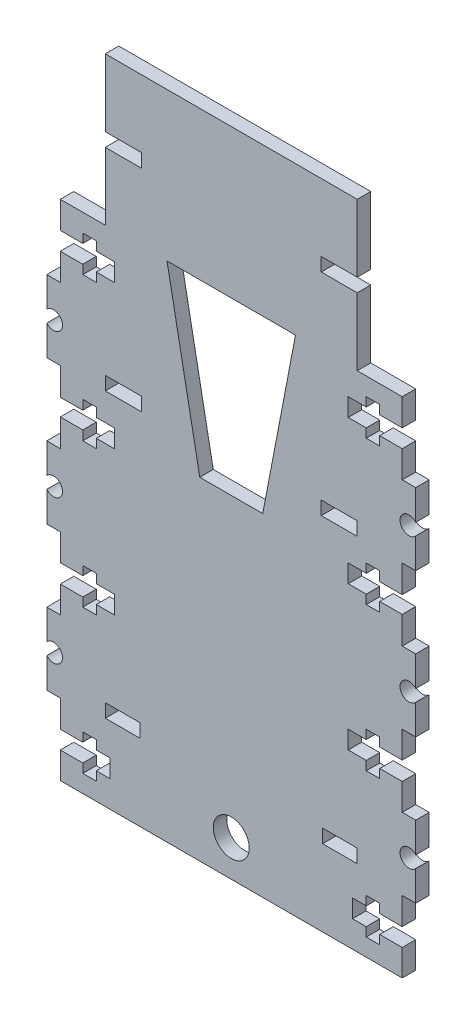
from build123d import *

# Parameters (mm, degrees)
SKETCH_1_W      = 7.702280229
SKETCH_1_H      = 3
SKETCH_1_R      = 4
SKETCH_1_W_2    = 8
EXTRUDE_1_DEPTH = 3


with BuildPart() as part:
    # 草图1 → 凸台-拉伸1 (new body)
    with BuildSketch(Plane.XY):
        with BuildLine():
            Line((0, 21.943589238), (0, 16))
            Line((0, 16), (-3, 16))
            Line((-3, 16), (-3, 9.322875656))
            ThreePointArc((-3, 9.322875656), (-0.792893219, 9.870828693), (0.5, 8))
            ThreePointArc((0.5, 8), (-0.792893219, 6.129171307), (-3, 6.677124344))
            Line((-3, 6.677124344), (-3, 0))
            Line((-3, 0), (0, 0))
            Line((0, 0), (0, -6))
            Line((0, -6), (5, -6))
            Line((5, -6), (5, -4))
            Line((5, -4), (8, -4))
            Line((8, -4), (8, -6))
            Line((8, -6), (11.049435588, -6))
            Line((11.049435588, -6), (11.049435588, -10))
            Line((11.049435588, -10), (8, -10))
            Line((8, -10), (8, -12))
            Line((8, -12), (5, -12))
            Line((5, -12), (5, -10))
            Line((5, -10), (0, -10))
            Line((0, -10), (0, -15.884432035))
            Line((0, -15.884432035), (76, -15.884432035))
            Line((76, -15.884432035), (76, -10))
            Line((76, -10), (71, -10))
            Line((71, -10), (71, -12))
            Line((71, -12), (68, -12))
            Line((68, -12), (68, -10))
            Line((68, -10), (64.950564412, -10))
            Line((64.950564412, -10), (64.950564412, -6))
            Line((64.950564412, -6), (68, -6))
            Line((68, -6), (68, -4))
            Line((68, -4), (71, -4))
            Line((71, -4), (71, -6))
            Line((71, -6), (76, -6))
            Line((76, -6), (76, 0))
            Line((76, 0), (79, 0))
            Line((79, 0), (79, 6.677124344))
            ThreePointArc((79, 6.677124344), (75.5, 8), (79, 9.322875656))
            Line((79, 9.322875656), (79, 16))
            Line((79, 16), (76, 16))
            Line((76, 16), (76, 21.943589238))
            Line((76, 21.943589238), (71, 21.943589238))
            Line((71, 21.943589238), (71, 20))
            Line((71, 20), (68, 20))
            Line((68, 20), (68, 22))
            Line((68, 22), (64, 22))
            Line((64, 22), (64, 26))
            Line((64, 26), (68, 26))
            Line((68, 26), (68, 28))
            Line((68, 28), (71, 28))
            Line((71, 28), (71, 26.056410762))
            Line((71, 26.056410762), (76, 26.056410762))
            Line((76, 26.056410762), (76, 32))
            Line((76, 32), (79, 32))
            Line((79, 32), (79, 38.677124344))
            ThreePointArc((79, 38.677124344), (75.5, 40), (79, 41.322875656))
            Line((79, 41.322875656), (79, 48))
            Line((79, 48), (76, 48))
            Line((76, 48), (76, 54.106340664))
            Line((76, 54.106340664), (71, 54.106340664))
            Line((71, 54.106340664), (71, 52))
            Line((71, 52), (68, 52))
            Line((68, 52), (68, 54))
            Line((68, 54), (64, 54))
            Line((64, 54), (64, 58))
            Line((64, 58), (68, 58))
            Line((68, 58), (68, 60))
            Line((68, 60), (71, 60))
            Line((71, 60), (71, 57.893659336))
            Line((71, 57.893659336), (76, 57.893659336))
            Line((76, 57.893659336), (76, 64))
            Line((76, 64), (79, 64))
            Line((79, 64), (79, 70.677124344))
            ThreePointArc((79, 70.677124344), (75.5, 72), (79, 73.322875656))
            Line((79, 73.322875656), (79, 80))
            Line((79, 80), (76, 80))
            Line((76, 80), (76, 86))
            Line((76, 86), (71, 86))
            Line((71, 86), (71, 84))
            Line((71, 84), (68, 84))
            Line((68, 84), (68, 86))
            Line((68, 86), (64, 86))
            Line((64, 86), (64, 90))
            Line((64, 90), (68, 90))
            Line((68, 90), (68, 92))
            Line((68, 92), (71, 92))
            Line((71, 92), (71, 90))
            Line((71, 90), (76, 90))
            Line((76, 90), (76, 96))
            Line((76, 96), (66, 96))
            Line((66, 96), (66, 111))
            Line((66, 111), (58, 111))
            Line((58, 111), (58, 114))
            Line((58, 114), (66, 114))
            Line((66, 114), (66, 129))
            Line((66, 129), (10, 129))
            Line((10, 129), (10, 114))
            Line((10, 114), (18, 114))
            Line((18, 114), (18, 111))
            Line((18, 111), (10, 111))
            Line((10, 111), (10, 96))
            Line((10, 96), (0, 96))
            Line((0, 96), (0, 90))
            Line((0, 90), (5, 90))
            Line((5, 90), (5, 92))
            Line((5, 92), (8, 92))
            Line((8, 92), (8, 90))
            Line((8, 90), (12, 90))
            Line((12, 90), (12, 86))
            Line((12, 86), (8, 86))
            Line((8, 86), (8, 84))
            Line((8, 84), (5, 84))
            Line((5, 84), (5, 86))
            Line((5, 86), (0, 86))
            Line((0, 86), (0, 80))
            Line((0, 80), (-3, 80))
            Line((-3, 80), (-3, 73.322875656))
            ThreePointArc((-3, 73.322875656), (-0.792893219, 73.870828693), (0.5, 72))
            ThreePointArc((0.5, 72), (-0.792893219, 70.129171307), (-3, 70.677124344))
            Line((-3, 70.677124344), (-3, 64))
            Line((-3, 64), (0, 64))
            Line((0, 64), (0, 57.893659336))
            Line((0, 57.893659336), (5, 57.893659336))
            Line((5, 57.893659336), (5, 60))
            Line((5, 60), (8, 60))
            Line((8, 60), (8, 58))
            Line((8, 58), (12, 58))
            Line((12, 58), (12, 54))
            Line((12, 54), (8, 54))
            Line((8, 54), (8, 52))
            Line((8, 52), (5, 52))
            Line((5, 52), (5, 54.106340664))
            Line((5, 54.106340664), (0, 54.106340664))
            Line((0, 54.106340664), (0, 48))
            Line((0, 48), (-3, 48))
            Line((-3, 48), (-3, 41.322875656))
            ThreePointArc((-3, 41.322875656), (-0.792893219, 41.870828693), (0.5, 40))
            ThreePointArc((0.5, 40), (-0.792893219, 38.129171307), (-3, 38.677124344))
            Line((-3, 38.677124344), (-3, 32))
            Line((-3, 32), (0, 32))
            Line((0, 32), (0, 26.056410762))
            Line((0, 26.056410762), (5, 26.056410762))
            Line((5, 26.056410762), (5, 28))
            Line((5, 28), (8, 28))
            Line((8, 28), (8, 26))
            Line((8, 26), (12, 26))
            Line((12, 26), (12, 22))
            Line((12, 22), (8, 22))
            Line((8, 22), (8, 20))
            Line((8, 20), (5, 20))
            Line((5, 20), (5, 21.943589238))
            Line((5, 21.943589238), (0, 21.943589238))
        make_face()
        with Locations((13.851140114, 2.615567965)):
            Rectangle(SKETCH_1_W, SKETCH_1_H, mode=Mode.SUBTRACT)
        with Locations((38, -7.884432035)):
            Circle(SKETCH_1_R, mode=Mode.SUBTRACT)
        with Locations((62.148859886, 2.615567965)):
            Rectangle(SKETCH_1_W, SKETCH_1_H, mode=Mode.SUBTRACT)
        with Locations((14, 65.615567965)):
            Rectangle(SKETCH_1_W_2, SKETCH_1_H, mode=Mode.SUBTRACT)
        Polygon((31, 58), (23.720595315, 96), (52.279404685, 96), (45, 58), align=None, mode=Mode.SUBTRACT)
        with Locations((62, 65.615567965)):
            Rectangle(SKETCH_1_W_2, SKETCH_1_H, mode=Mode.SUBTRACT)
    extrude(amount=EXTRUDE_1_DEPTH)


solid = part.part
